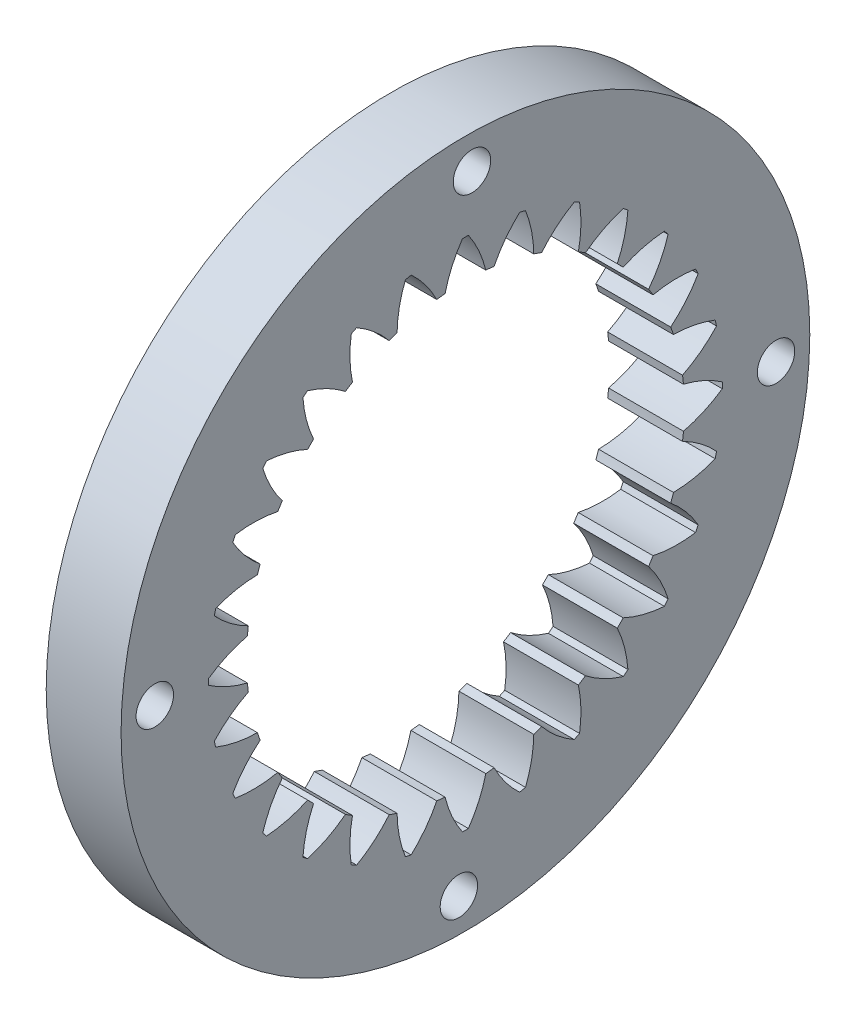
from build123d import *

# Parameters (mm, degrees)
BASPROSKE_W        = 10
BASPROSKE_H        = 16.75
TOOTHCUT_DEPTH     = 66.817930688
TEETHCUTS_COUNT    = 28
TEETHCUTS_ANGLE    = 347.142857143
SKETCH1_R          = 2.5
CUT_EXTRUDE1_DEPTH = 10


with BuildPart() as part:
    # BasProSke → Base-Revolve (revolve)
    with BuildSketch(Plane(origin=(0, 0, 0), x_dir=(1, 0, 0), z_dir=(0, 1, 0))):
        with Locations((5, 37.625)):
            Rectangle(BASPROSKE_W, BASPROSKE_H)
    revolve(axis=Axis((-10, 0, 0), (1, 0, 0)))

    # TooCutSke → ToothCut (cut, through all)
    with BuildSketch(Plane(origin=(0, 0, 0), x_dir=(0, 0, -1), z_dir=(1, 0, 0))):
        with BuildLine():
            ThreePointArc((2.723925978, 29.097379133), (1.798550898, 31.810630704), (0.396704743, 34.311206735))
            ThreePointArc((0.396704743, 34.311206735), (0, 34.3135), (-0.396704743, 34.311206735))
            ThreePointArc((-0.396704743, 34.311206735), (-1.798550898, 31.810630704), (-2.723925978, 29.097379133))
            ThreePointArc((-2.723925978, 29.097379133), (0, 29.2246), (2.723925978, 29.097379133))
        make_face()
    toothcut = extrude(amount=TOOTHCUT_DEPTH, mode=Mode.SUBTRACT)

    # TeethCuts: ToothCut ×28 about axis
    teethcuts_axis = Axis((-10, 0, 0), (1, 0, 0))
    for i in range(1, TEETHCUTS_COUNT):
        add(toothcut.rotate(teethcuts_axis, i * TEETHCUTS_ANGLE / (TEETHCUTS_COUNT - 1)), mode=Mode.SUBTRACT)

    # Sketch1 → Cut-Extrude1 (cut)
    with BuildSketch(Plane.ZY):
        with Locations((41.49082566, 0.872574377)):
            Circle(SKETCH1_R)
        with Locations((0.872574377, -41.49082566)):
            Circle(SKETCH1_R)
        with Locations((-41.49082566, -0.872574377)):
            Circle(SKETCH1_R)
        with Locations((-0.872574377, 41.49082566)):
            Circle(SKETCH1_R)
    extrude(amount=-CUT_EXTRUDE1_DEPTH, mode=Mode.SUBTRACT)


solid = part.part
